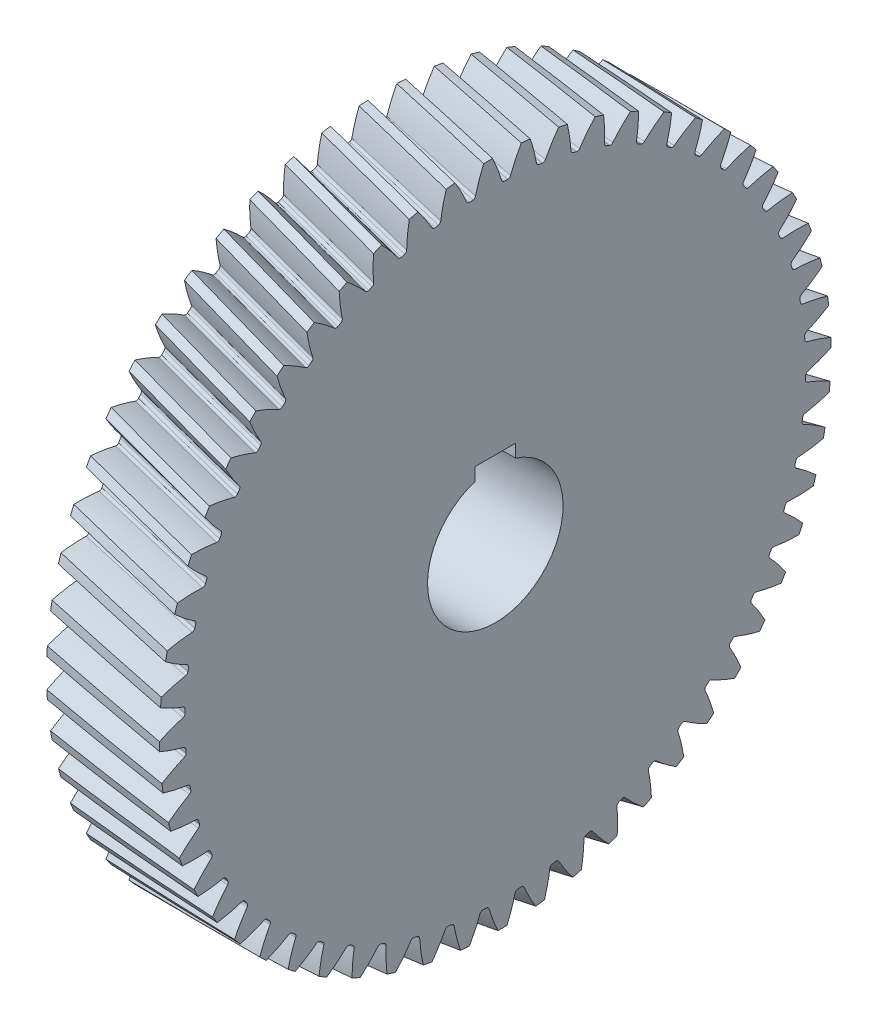
from build123d import *

# Parameters (mm, degrees)
BASPROSKE_W            = 50
BASPROSKE_H            = 148.682575091
TOOTHCUTRH_PITCH       = 4046.465503504
TOOTHCUTRH_HEIGHT      = 50
TOOTHCUTRH_RADIUS      = 148.682575091
TOOTHCUTRH_START_ANGLE = -90
TEETHCUTSRH_COUNT      = 56
TEETHCUTSRH_ANGLE      = 353.571428571
BORSKE_R               = 30
BORE_DEPTH             = 62.5000025
KEYSKE_W               = 18
KEYSKE_H               = 34.4
KEYWAY_DEPTH           = 62.5000025


with BuildPart() as part:
    # BasProSke → Base-Revolve (revolve)
    with BuildSketch(Plane(origin=(0, 0, 0), x_dir=(1, 0, 0), z_dir=(0, 1, 0)), mode=Mode.PRIVATE) as base_revolve_sk:
        with Locations((25, 74.341287546)):
            Rectangle(BASPROSKE_W, BASPROSKE_H)
    revolve(base_revolve_sk.sketch.rotate(Axis((-10, 0, 0), (1, 0, 0)), 180), axis=Axis((-10, 0, 0), (1, 0, 0)))

    # ToothCutRH: sweep along a helix
    with BuildLine() as toothcutrh_path:
        add(Helix(TOOTHCUTRH_PITCH, TOOTHCUTRH_HEIGHT, TOOTHCUTRH_RADIUS, center=(0, 0, 0), direction=(1, 0, 0), mode=Mode.PRIVATE).rotate(Axis((0, 0, 0), (1, 0, 0)), TOOTHCUTRH_START_ANGLE))
    # TooCutSkeRH → ToothCutRH (sweep, cut)
    with BuildSketch(Plane(origin=(0, 0, 0), x_dir=(0, 0, -1), z_dir=(1, 0, 0))):
        with BuildLine():
            ThreePointArc((0.79202982, 137.430292821), (0, 137.432575091), (-0.79202982, 137.430292821))
            ThreePointArc((-0.79202982, 137.430292821), (-1.526383062, 137.663301971), (-1.984947868, 138.282403147))
            ThreePointArc((-1.984947868, 138.282403147), (-5.000787225, 145.783309004), (-8.861366818, 152.886463296))
            ThreePointArc((-8.861366818, 152.886463296), (0, 153.143052344), (8.861366818, 152.886463296))
            ThreePointArc((8.861366818, 152.886463296), (5.000787225, 145.783309004), (1.984947868, 138.282403147))
            ThreePointArc((1.984947868, 138.282403147), (1.526383062, 137.663301971), (0.79202982, 137.430292821))
        make_face()
    toothcutrh = sweep(path=toothcutrh_path.line, is_frenet=True, mode=Mode.SUBTRACT)

    # TeethCutsRH: ToothCutRH ×56 about axis
    teethcutsrh_axis = Axis((-10, 0, 0), (1, 0, 0))
    for i in range(1, TEETHCUTSRH_COUNT):
        add(toothcutrh.rotate(teethcutsrh_axis, i * TEETHCUTSRH_ANGLE / (TEETHCUTSRH_COUNT - 1)), mode=Mode.SUBTRACT)

    # BorSke → Bore (cut, symmetric)
    with BuildSketch(Plane(origin=(0, 0, 0), x_dir=(0, 0, -1), z_dir=(1, 0, 0))):
        with Locations(Location((0, 0, 0), (0, 0, 180))):
            Circle(BORSKE_R)
    extrude(amount=BORE_DEPTH, both=True, mode=Mode.SUBTRACT)

    # KeySke → Keyway (cut, symmetric)
    with BuildSketch(Plane(origin=(0, 0, 0), x_dir=(0, 0, -1), z_dir=(1, 0, 0))):
        with Locations((0, 17.2)):
            Rectangle(KEYSKE_W, KEYSKE_H)
    extrude(amount=KEYWAY_DEPTH, both=True, mode=Mode.SUBTRACT)


solid = part.part
